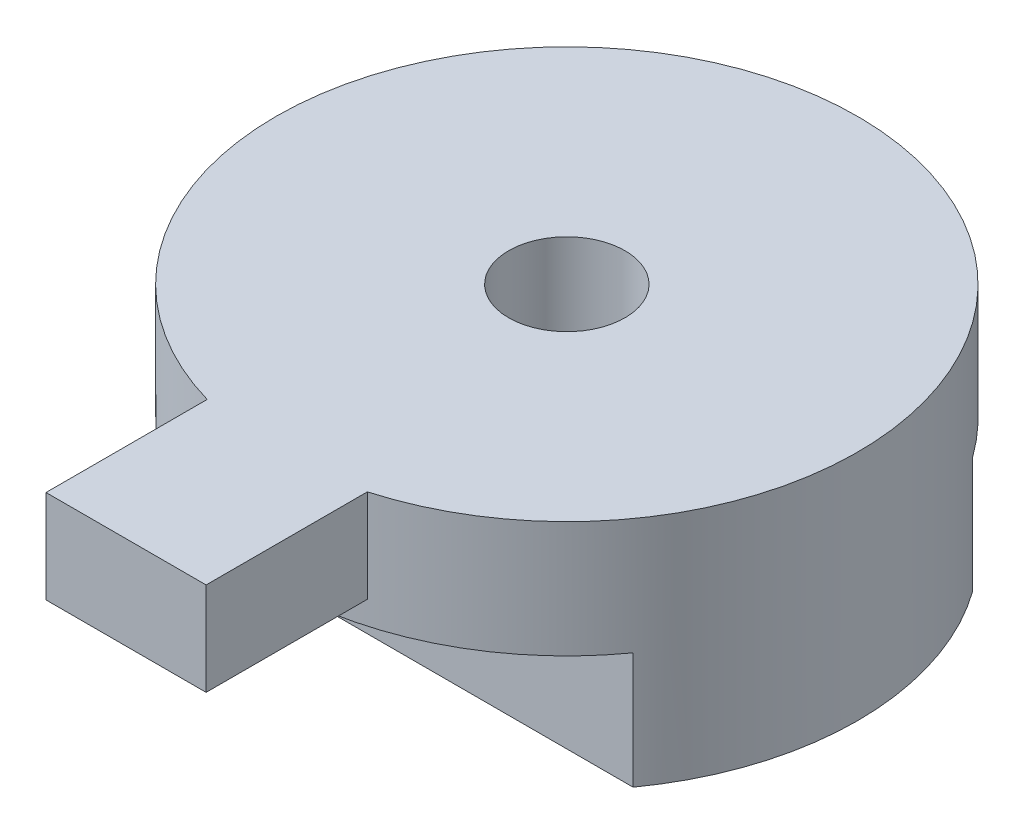
from build123d import *

# Parameters (mm, degrees)
SKETCH1_R               = 15.875
BOSS_EXTRUDE1_DEPTH     = 12.7
CUT_EXTRUDE1_DEPTH      = 26.793821935
CUT_EXTRUDE1_DEPTH_BACK = 26.793821935
SKETCH2_W               = 6.604
SKETCH2_H               = 6.35
SKETCH3_R               = 3.175
CUT_EXTRUDE2_DEPTH      = 12.7
SKETCH4_W               = 8.740827258
SKETCH4_H               = 16.374213706
BOSS_EXTRUDE2_DEPTH     = 5.08


with BuildPart() as part:
    # Sketch1 → Boss-Extrude1 (new body)
    with BuildSketch(Plane(origin=(0, 0, 0), x_dir=(1, 0, 0), z_dir=(0, 1, 0))):
        Circle(SKETCH1_R)
    extrude(amount=BOSS_EXTRUDE1_DEPTH)

    # Sketch2 → Cut-Extrude1 (cut, two sides: drawn at the far end of the back side and taken through both)
    with BuildSketch(Plane(origin=(0, 0, 0), x_dir=(0, 0, -1), z_dir=(1, 0, 0)).offset(-CUT_EXTRUDE1_DEPTH_BACK)):
        with Locations((12.573, 3.175)):
            Rectangle(SKETCH2_W, SKETCH2_H)
        with Locations((-12.573, 3.175)):
            Rectangle(SKETCH2_W, SKETCH2_H)
    extrude(amount=CUT_EXTRUDE1_DEPTH + CUT_EXTRUDE1_DEPTH_BACK, mode=Mode.SUBTRACT)

    # Sketch3 → Cut-Extrude2 (cut)
    with BuildSketch(Plane(origin=(0, 12.7, 0), x_dir=(1, 0, 0), z_dir=(0, 1, 0))):
        Circle(SKETCH3_R)
    extrude(amount=-CUT_EXTRUDE2_DEPTH, mode=Mode.SUBTRACT)

    # Sketch4 → Boss-Extrude2 (add)
    with BuildSketch(Plane(origin=(0, 12.7, 0), x_dir=(1, 0, 0), z_dir=(0, 1, 0))):
        with Locations((0, -15.875)):
            Rectangle(SKETCH4_W, SKETCH4_H)
    extrude(amount=-BOSS_EXTRUDE2_DEPTH)


solid = part.part
